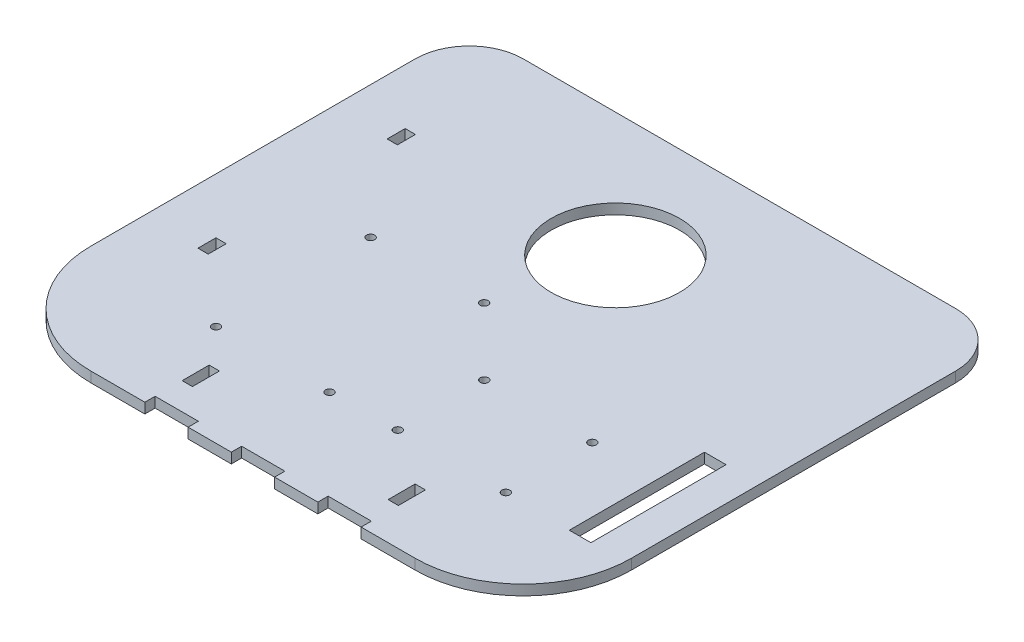
from build123d import *

# Parameters (mm, degrees)
SKETCH1_W           = 254
SKETCH1_H           = 228.6
BOSS_EXTRUDE1_DEPTH = 4.826
CUT_EXTRUDE3_DEPTH  = 4.826
SKETCH19_W          = 4.826
SKETCH19_H          = 8.466666666
CUT_EXTRUDE16_DEPTH = 171.929167423
FILLET11_R          = 50.8
SKETCH20_W          = 10.16
SKETCH20_H          = 63.5
CUT_EXTRUDE17_DEPTH = 171.929167423
SKETCH23_R          = 1.905
CUT_EXTRUDE18_DEPTH = 171.929167423
SKETCH24_W          = 20.32
SKETCH24_H          = 4.826
CUT_EXTRUDE19_DEPTH = 171.929167423
SKETCH26_R          = 30.1625
CUT_EXTRUDE20_DEPTH = 171.929167423
SKETCH27_W          = 4.826
SKETCH27_H          = 12.7
CUT_EXTRUDE21_DEPTH = 171.929167423


with BuildPart() as part:
    # Sketch1 → Boss-Extrude1 (new body)
    with BuildSketch(Plane(origin=(0, 0, 0), x_dir=(1, 0, 0), z_dir=(0, 1, 0))):
        Rectangle(SKETCH1_W, SKETCH1_H)
    extrude(amount=BOSS_EXTRUDE1_DEPTH)

    # Sketch4 → Cut-Extrude3 (cut)
    with BuildSketch(Plane(origin=(0, 4.826, 0), x_dir=(1, 0, 0), z_dir=(0, 1, 0))):
        with BuildLine():
            Line((-127, 88.9), (-127, 114.3))
            Line((-127, 114.3), (-101.6, 114.3))
            ThreePointArc((-101.6, 114.3), (-119.560512242, 106.860512242), (-127, 88.9))
        make_face()
        with BuildLine():
            Line((127, 88.9), (127, 114.3))
            Line((127, 114.3), (101.6, 114.3))
            ThreePointArc((101.6, 114.3), (119.560512242, 106.860512242), (127, 88.9))
        make_face()
    extrude(amount=-CUT_EXTRUDE3_DEPTH, mode=Mode.SUBTRACT)

    # Sketch19 → Cut-Extrude16 (cut, through all)
    with BuildSketch(Plane(origin=(0, 4.826, 0), x_dir=(1, 0, 0), z_dir=(0, 1, 0))):
        with Locations((-98.58699993, -34.925)):
            Rectangle(SKETCH19_W, SKETCH19_H)
        with Locations((-98.58699993, 53.975)):
            Rectangle(SKETCH19_W, SKETCH19_H)
    extrude(amount=-CUT_EXTRUDE16_DEPTH, mode=Mode.SUBTRACT)

    # Fillet11
    fillet11_edges = [part.edges().sort_by_distance(p)[0] for p in [
        (-127, 2.413, 114.3),
        (127, 2.413, 114.3),
    ]]
    fillet(fillet11_edges, radius=FILLET11_R)

    # Sketch20 → Cut-Extrude17 (cut, through all)
    with BuildSketch(Plane.XZ):
        with Locations((106.07999993, 34.925)):
            Rectangle(SKETCH20_W, SKETCH20_H)
    extrude(amount=-CUT_EXTRUDE17_DEPTH, mode=Mode.SUBTRACT)

    # Sketch23 → Cut-Extrude18 (cut, through all)
    with BuildSketch(Plane(origin=(0, 4.826, 0), x_dir=(1, 0, 0), z_dir=(0, 1, 0))):
        with Locations((70.741119647, -25.576370111)):
            Circle(SKETCH23_R)
        with Locations((70.741119647, -66.216370111)):
            Circle(SKETCH23_R)
        with Locations((19.941119647, -25.576370111)):
            Circle(SKETCH23_R)
        with Locations((19.941119647, -66.216370111)):
            Circle(SKETCH23_R)
        with Locations((-11.48044922, 5.792629889)):
            Circle(SKETCH23_R)
        with Locations((-64.82044922, 5.792629889)):
            Circle(SKETCH23_R)
        with Locations((-64.82044922, -66.851370111)):
            Circle(SKETCH23_R)
        with Locations((-11.48044922, -66.851370111)):
            Circle(SKETCH23_R)
    extrude(amount=-CUT_EXTRUDE18_DEPTH, mode=Mode.SUBTRACT)

    # Sketch24 → Cut-Extrude19 (cut, through all)
    with BuildSketch(Plane.XZ):
        with Locations((-40.64, 111.887)):
            Rectangle(SKETCH24_W, SKETCH24_H)
        with Locations((0, 111.887)):
            Rectangle(SKETCH24_W, SKETCH24_H)
        with Locations((40.64, 111.887)):
            Rectangle(SKETCH24_W, SKETCH24_H)
    extrude(amount=-CUT_EXTRUDE19_DEPTH, mode=Mode.SUBTRACT)

    # Sketch26 → Cut-Extrude20 (cut, through all)
    with BuildSketch(Plane.XZ):
        with Locations((0, -55.982011538)):
            Circle(SKETCH26_R)
    extrude(amount=-CUT_EXTRUDE20_DEPTH, mode=Mode.SUBTRACT)

    # Sketch27 → Cut-Extrude21 (cut, through all)
    with BuildSketch(Plane.XZ):
        with Locations((-48.387, 90.424)):
            Rectangle(SKETCH27_W, SKETCH27_H)
        with Locations((48.387, 90.424)):
            Rectangle(SKETCH27_W, SKETCH27_H)
    extrude(amount=-CUT_EXTRUDE21_DEPTH, mode=Mode.SUBTRACT)


solid = part.part
